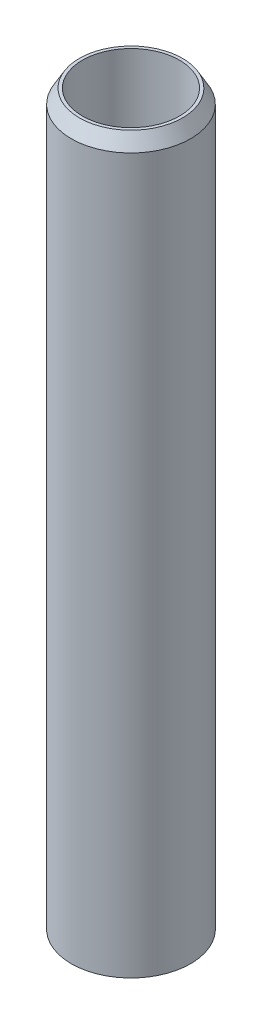
from build123d import *

# Parameters (mm, degrees)
SKETCH1_R           = 25
BOSS_EXTRUDE1_DEPTH = 308.600418
SKETCH2_R           = 20.329088143
CUT_EXTRUDE1_DEPTH  = 311.619088257
CHAMFER1_SIZE       = 5.871972
CHAMFER1_SIZE_2     = 3.390185


with BuildPart() as part:
    # Sketch1 → Boss-Extrude1 (new body)
    with BuildSketch(Plane(origin=(0, 0, 0), x_dir=(1, 0, 0), z_dir=(0, 1, 0))):
        with Locations(Location((0, 0, 0), (0, 0, 270))):
            Circle(SKETCH1_R)
    extrude(amount=BOSS_EXTRUDE1_DEPTH)

    # Sketch2 → Cut-Extrude1 (cut, through all)
    with BuildSketch(Plane(origin=(0, 0, 0), x_dir=(1, 0, 0), z_dir=(0, 1, 0))):
        with Locations(Location((0, 0, 0), (0, 0, 270))):
            Circle(SKETCH2_R)
    extrude(amount=CUT_EXTRUDE1_DEPTH, mode=Mode.SUBTRACT)

    # Chamfer1
    # the kernel refuses this chamfer: 5.871972, 3.390185 mm, written as the material it takes off along each edge
    with BuildSketch(Plane(origin=(0, 308.600418, 0), x_dir=(0, 0, 1), z_dir=(-1, 0, 0))) as chamfer1_piece_1:
        Polygon((25, -CHAMFER1_SIZE), (25 - CHAMFER1_SIZE_2, 0), (25, 0), align=None)
    revolve(axis=Axis((0, 308.600418, 0), (0, 1, 0)), mode=Mode.SUBTRACT)
    with BuildSketch(Plane(origin=(0, 0, 0), x_dir=(0, 0, 1), z_dir=(-1, 0, 0))) as chamfer1_piece_2:
        Polygon((25, CHAMFER1_SIZE_2), (25 - CHAMFER1_SIZE, 0), (25, 0), align=None)
    revolve(axis=Axis((0, 0, 0), (0, 1, 0)), mode=Mode.SUBTRACT)


solid = part.part
